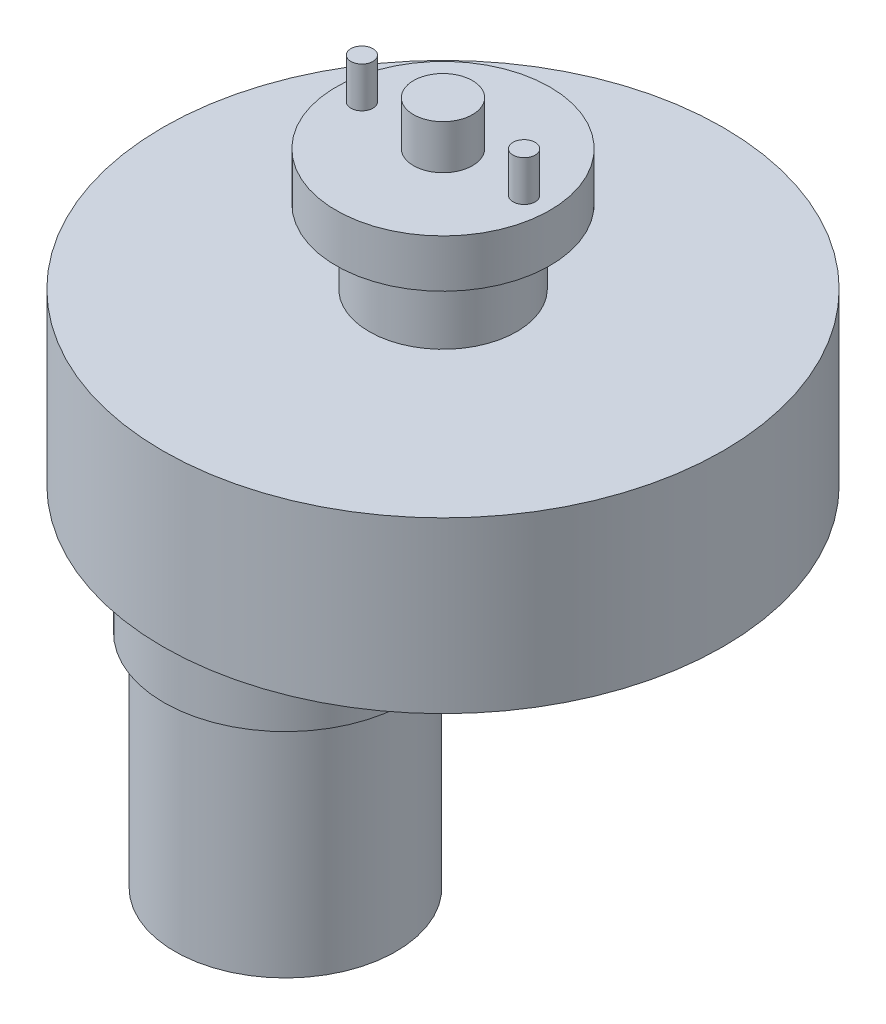
from build123d import *

# Parameters (mm, degrees)
SKETCH_1_R      = 38
EXTRUDE_1_DEPTH = 23
SKETCH_2_R      = 10
EXTRUDE_2_DEPTH = 10
SKETCH_3_R      = 14.5
EXTRUDE_3_DEPTH = 6.5
SKETCH_4_R      = 4
EXTRUDE_4_DEPTH = 6
SKETCH_5_R      = 1.5
EXTRUDE_5_DEPTH = 5.5
SKETCH_6_R      = 16.5
EXTRUDE_6_DEPTH = 28
SKETCH_7_R      = 15
EXTRUDE_7_DEPTH = 30


with BuildPart() as part:
    # Эскиз1 → Вытянуть1 (new body)
    with BuildSketch(Plane(origin=(0, 0, 0), x_dir=(1, 0, 0), z_dir=(0, 1, 0))):
        Circle(SKETCH_1_R)
    extrude(amount=EXTRUDE_1_DEPTH)

    # Эскиз2 → Вытянуть2 (add)
    with BuildSketch(Plane(origin=(0, 23, 0), x_dir=(1, 0, 0), z_dir=(0, 1, 0))):
        Circle(SKETCH_2_R)
    extrude(amount=EXTRUDE_2_DEPTH)

    # Эскиз3 → Вытянуть3 (add)
    with BuildSketch(Plane(origin=(0, 33, 0), x_dir=(1, 0, 0), z_dir=(0, 1, 0))):
        Circle(SKETCH_3_R)
    extrude(amount=EXTRUDE_3_DEPTH)

    # Эскиз4 → Вытянуть4 (add)
    with BuildSketch(Plane(origin=(0, 39.5, 0), x_dir=(-1, 0, 0), z_dir=(0, 1, 0))):
        Circle(SKETCH_4_R)
    extrude(amount=EXTRUDE_4_DEPTH)

    # Эскиз5 → Вытянуть5 (add)
    with BuildSketch(Plane(origin=(0, 39.5, 0), x_dir=(-1, 0, 0), z_dir=(0, 1, 0))):
        with Locations((11, 0)):
            Circle(SKETCH_5_R)
        with Locations((-11, 0)):
            Circle(SKETCH_5_R)
    extrude(amount=EXTRUDE_5_DEPTH)

    # Эскиз6 → Вытянуть6 (add)
    with BuildSketch(Plane.XZ):
        with Locations((-21.372740523, 0)):
            Circle(SKETCH_6_R)
    extrude(amount=EXTRUDE_6_DEPTH)

    # Эскиз7 → Вытянуть7 (add)
    with BuildSketch(Plane.XZ.offset(28)):
        with Locations((-21.372740523, 0)):
            Circle(SKETCH_7_R)
    extrude(amount=EXTRUDE_7_DEPTH)


solid = part.part
